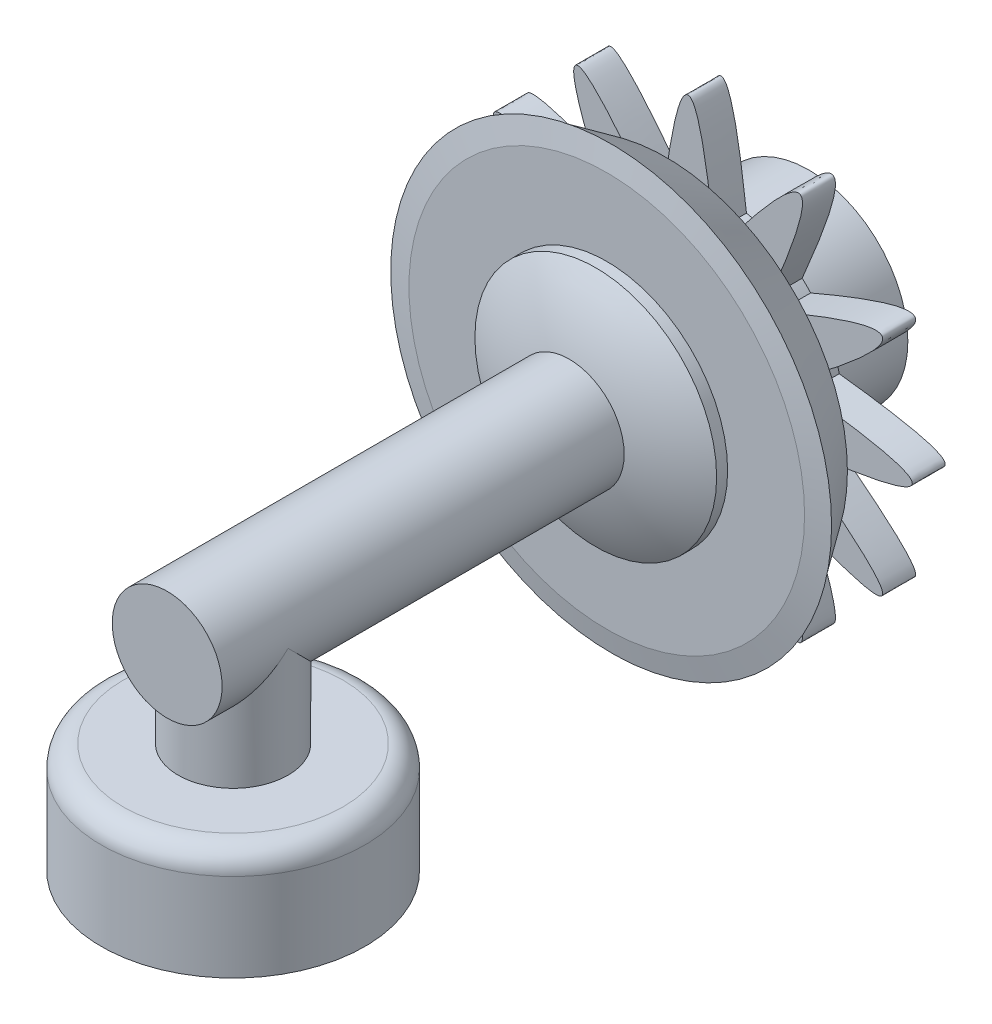
from build123d import *
from build123d.topology import SkipClean

# Parameters (mm, degrees)
SKETCH1_R                = 5.5
GEARPLATE_DEPTH          = 1.5
BOSS_EXTRUDE3_DEPTH      = 1.5
CIRPATTERN2_COUNT        = 12
SKETCH3_R                = 4.5
BACKPLATE_DEPTH          = 4
SKETCH4_R                = 5.5
PLATE_DEPTH              = 1
SKETCH6_R                = 10
ANGLEPLATE_DEPTH         = 2.5
ANGLEPLATE_DRAFT         = -35
SKETCH8_R                = 9
SMALLANGLEPLATE_DEPTH    = 0.2
SMALLANGLEPLATE_DRAFT    = 79
SKETCH9_R                = 5.5
DOMEEXTRUDE_DEPTH        = 0.5
CUT_EXTRUDE1_DEPTH       = 3.8
BOSS_EXTRUDE5_REACH      = 34.569
BOSS_EXTRUDE5_END_RADIUS = 10.833333333
SKETCH12_R               = 2.5
SKETCH15_R               = 2.5
BOSS_EXTRUDE6_DEPTH      = 5
SKETCH16_R               = 6
BOSS_EXTRUDE7_DEPTH      = 5
FILLET1_R                = 1


# Read off the part's stored shape, not the designer's step: Dome1
with BuildPart() as part:
    # Sketch1 → GearPlate (new body)
    with BuildSketch(Plane.XY):
        Circle(SKETCH1_R)
    extrude(amount=GEARPLATE_DEPTH)

    # Sketch2 → Boss-Extrude3 (add)
    with BuildSketch(Plane.XY.offset(1.5)):
        with BuildLine():
            Line((-1.157942076, 5.376724853), (1.157942076, 5.376724853))
            add(Edge.make_bspline(
                [(-1.157942076, 5.376724853), (0, 15.022701543), (1.157942076, 5.376724853)],
                knots=[0, 0, 0, 1, 1, 1], degree=2))
        make_face()
    boss_extrude3 = extrude(amount=-BOSS_EXTRUDE3_DEPTH)

    # CirPattern2: Boss-Extrude3 ×12 about axis
    cirpattern2_axis = Axis((0, 0, 1.5), (0, 0, -1))
    for i in range(1, CIRPATTERN2_COUNT):
        add(boss_extrude3.rotate(cirpattern2_axis, i * 360 / CIRPATTERN2_COUNT))

    # Sketch3 → BackPlate (add)
    with BuildSketch(Plane(origin=(0, 0, 0), x_dir=(-1, 0, 0), z_dir=(0, 0, -1))):
        with Locations(Location((0, 0, 0), (0, 0, 180))):
            Circle(SKETCH3_R)
    extrude(amount=BACKPLATE_DEPTH)

    # Sketch4 → Plate (add)
    with BuildSketch(Plane.XY.offset(1.5)):
        with Locations(Location((0, 0, 0), (0, 0, 192.153701922))):
            Circle(SKETCH4_R)
    extrude(amount=PLATE_DEPTH)


with BuildPart() as angleplate_tool:
    # Sketch6 → AnglePlate (with draft: the straight prism first)
    with BuildSketch(Plane.XY.offset(5)):
        Circle(SKETCH6_R)
    extrude(amount=-ANGLEPLATE_DEPTH)
    # AnglePlate: the draft: its side faces are tilted about the plane it starts from
    angleplate_sides = [angleplate_tool.faces().sort_by_distance(p)[0] for p in [
        (-10, 0, 3.75),
    ]]
    draft(angleplate_sides, Plane.XY.offset(5), ANGLEPLATE_DRAFT)


with BuildPart() as part_1:
    add(part.part)

    # AnglePlate: add angleplate_tool
    add(angleplate_tool.part)


with BuildPart() as smallangleplate_tool:
    # Sketch8 → SmallAnglePlate (with draft: the straight prism first)
    with BuildSketch(Plane.XY.offset(5.2)):
        Circle(SKETCH8_R)
    extrude(amount=-SMALLANGLEPLATE_DEPTH)
    # SmallAnglePlate: the draft: its side faces are tilted about the plane it starts from
    smallangleplate_sides = [smallangleplate_tool.faces().sort_by_distance(p)[0] for p in [
        (-9, 0, 5.1),
    ]]
    draft(smallangleplate_sides, Plane.XY.offset(5.2), SMALLANGLEPLATE_DRAFT)


with BuildPart() as part_2:
    add(part_1.part)

    # SmallAnglePlate: add smallangleplate_tool
    add(smallangleplate_tool.part)

    # Sketch9 → DomeExtrude (add)
    with SkipClean():  # the faces are left unmerged after this step: merging them gives an invalid solid
        with BuildSketch(Plane.XY.offset(5.2)):
            with Locations(Location((0, 0, 0), (0, 0, 192.153701922))):
                Circle(SKETCH9_R)
        extrude(amount=DOMEEXTRUDE_DEPTH)

    # Dome1 outline → Dome1 (revolve)
    with SkipClean():  # the faces are left unmerged after this step: merging them gives an invalid solid
        with BuildSketch(Plane.XZ):
            with BuildLine():
                Line((0, 5.7), (5.500000009, 5.699999994))
                ThreePointArc((5.500000009, 5.699999994), (2.850438568, 6.818274729), (0, 7.2))
                Line((0, 7.2), (0, 5.7))
            make_face()
        revolve(axis=Axis((0, 0, 0), (0, 0, 1)))

    # Sketch11 → Cut-Extrude1 (cut)
    with SkipClean():  # the faces are left unmerged after this step: merging them gives an invalid solid
        with BuildSketch(Plane.XY.offset(10.2)):
            Polygon((-0.75, 2), (0.75, 2), (0.75, 0.75), (2, 0.75), (2, -0.75), (0.75, -0.75), (0.75, -2), (-0.75, -2), (-0.75, -0.75), (-2, -0.75), (-2, 0.75), (-0.75, 0.75), align=None)
        extrude(amount=-CUT_EXTRUDE1_DEPTH, mode=Mode.SUBTRACT)

    # Boss-Extrude5: up to this sphere (the profile starts outside it)
    with SkipClean():  # the faces are left unmerged after this step: merging them gives an invalid solid
        boss_extrude5_end = Location((0, 0, -3.633333333)) * Sphere(BOSS_EXTRUDE5_END_RADIUS, mode=Mode.PRIVATE)
        # Sketch12 → Boss-Extrude5 (add, up to the surface)
        with BuildSketch(Plane.XY.offset(25.2), mode=Mode.PRIVATE) as boss_extrude5_sk1:
            Circle(SKETCH12_R)
        boss_extrude5_tool1 = extrude(boss_extrude5_sk1.sketch, amount=-BOSS_EXTRUDE5_REACH, mode=Mode.PRIVATE) - boss_extrude5_end
        add(boss_extrude5_tool1.solids().sort_by_distance((0, 0, 25.2))[0])

    # Sketch15 → Boss-Extrude6 (add)
    with SkipClean():  # the faces are left unmerged after this step: merging them gives an invalid solid
        with BuildSketch(Plane(origin=(0, 0, 0), x_dir=(1, 0, 0), z_dir=(0, 1, 0))):
            with Locations(Location((0, -22.2, 0), (0, 0, 270))):
                Circle(SKETCH15_R)
        extrude(amount=-BOSS_EXTRUDE6_DEPTH)

    # Sketch16 → Boss-Extrude7 (add)
    with SkipClean():  # the faces are left unmerged after this step: merging them gives an invalid solid
        with BuildSketch(Plane.XZ.offset(5)):
            with Locations(Location((0, 22.2, 0), (0, 0, 270))):
                Circle(SKETCH16_R)
        extrude(amount=BOSS_EXTRUDE7_DEPTH)

    # Fillet1
    fillet1_edges = [part_2.edges().sort_by_distance(p)[0] for p in [
        (0, -5, 28.2),
    ]]
    fillet(fillet1_edges, radius=FILLET1_R)


solid = part_2.part
